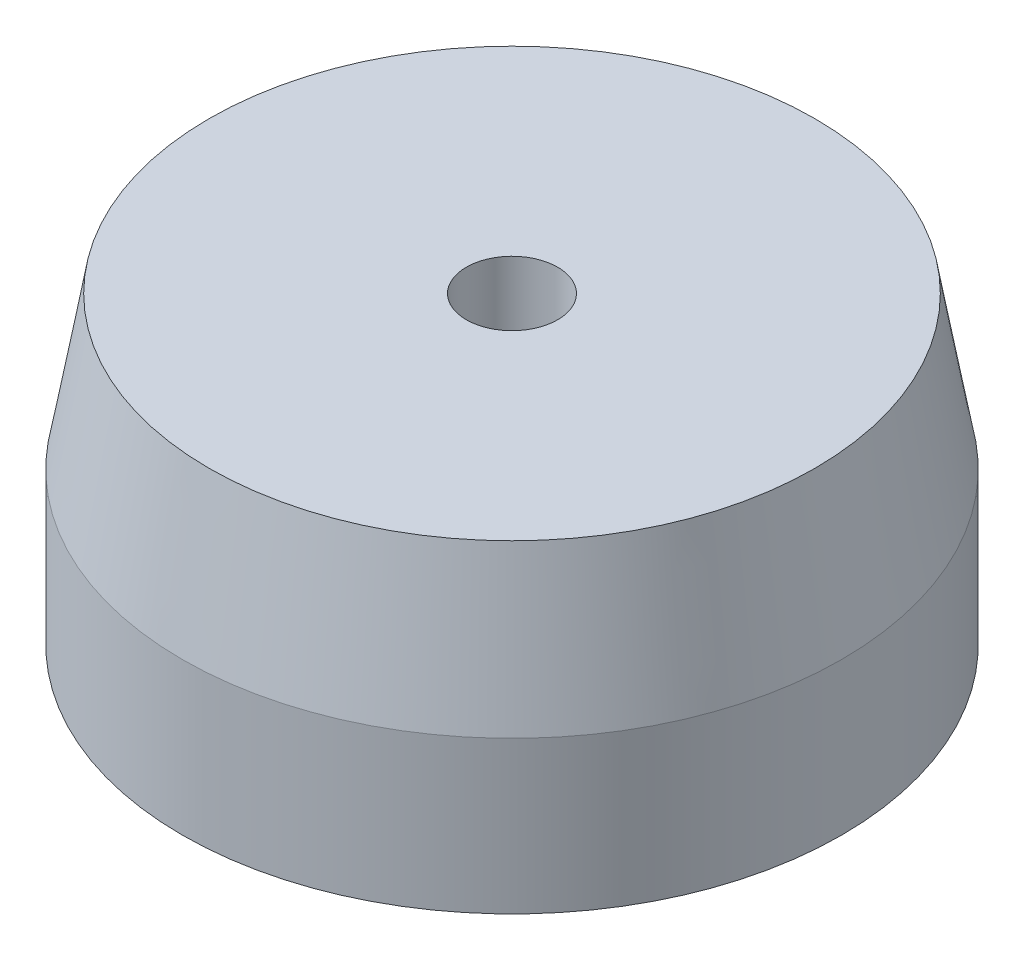
from build123d import *

# Parameters (mm, degrees)
SKETCH1_R           = 10.837
SKETCH1_R_2         = 1.5
BOSS_EXTRUDE1_DEPTH = 10
CHAMFER1_SIZE       = 5
CHAMFER1_SIZE2      = 0.881634904


with BuildPart() as part:
    # Sketch1 → Boss-Extrude1 (new body)
    with BuildSketch(Plane(origin=(0, 0, 0), x_dir=(1, 0, 0), z_dir=(0, 1, 0))):
        Circle(SKETCH1_R)
        Circle(SKETCH1_R_2, mode=Mode.SUBTRACT)
    extrude(amount=BOSS_EXTRUDE1_DEPTH)

    # Chamfer1
    chamfer1_edges = [part.edges().sort_by_distance(p)[0] for p in [
        (-10.837, 10, 0),
    ]]
    chamfer1_side = [part.faces().sort_by_distance(p)[0] for p in [
        (-10.837, 5, 0),
    ]]
    chamfer(chamfer1_edges, length=CHAMFER1_SIZE, length2=CHAMFER1_SIZE2, reference=chamfer1_side[0])


solid = part.part
